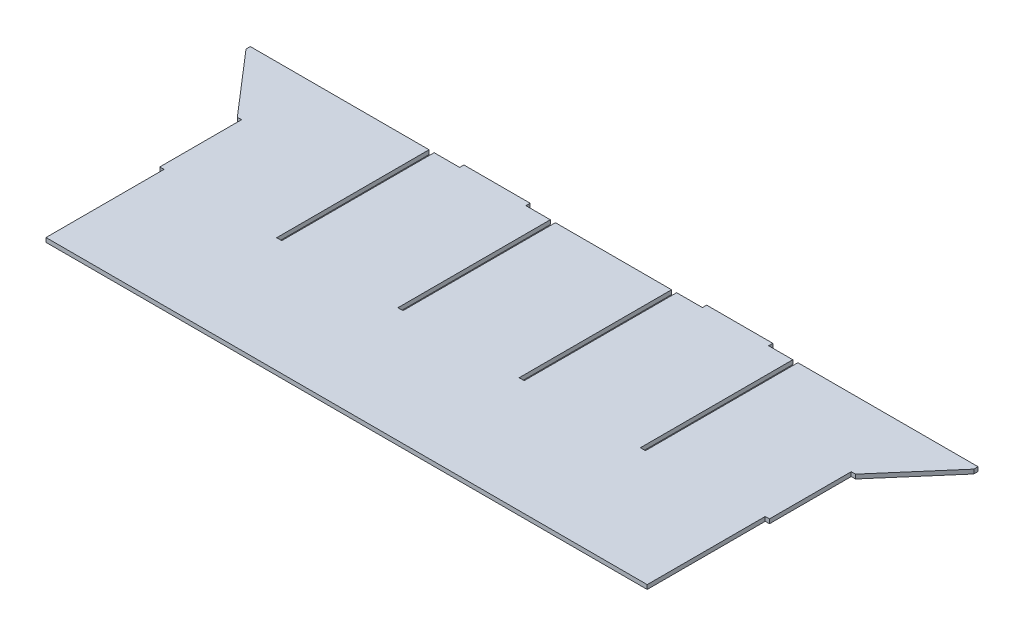
from build123d import *

# Parameters (mm, degrees)
SKETCH1_W           = 457.2230066
SKETCH1_H           = 3.175
BOSS_EXTRUDE1_DEPTH = 200.6419914
SKETCH2_W           = 3.8205
SKETCH2_H           = 114.3
CUT_EXTRUDE1_DEPTH  = 305.188278504
LPATTERN1_COUNT     = 4
LPATTERN1_PITCH     = 90.932
BOSS_EXTRUDE3_DEPTH = 3.175
SKETCH5_W           = 3.175
SKETCH5_H           = 88.514
CUT_EXTRUDE2_DEPTH  = 3.175
SKETCH3_W           = 49.658811606
SKETCH3_H           = 3.175
BOSS_EXTRUDE4_DEPTH = 3.18


with BuildPart() as part:
    # Sketch1 → Boss-Extrude1 (new body)
    with BuildSketch(Plane.XY):
        Rectangle(SKETCH1_W, SKETCH1_H)
    extrude(amount=BOSS_EXTRUDE1_DEPTH)

    # Sketch2 → Cut-Extrude1 (cut, through all)
    with BuildSketch(Plane(origin=(0, 1.5875, 0), x_dir=(1, 0, 0), z_dir=(0, 1, 0))):
        with Locations((135.8962533, -57.15)):
            Rectangle(SKETCH2_W, SKETCH2_H)
    cut_extrude1 = extrude(amount=-CUT_EXTRUDE1_DEPTH, mode=Mode.SUBTRACT)

    # LPattern1: Cut-Extrude1 ×4
    with Locations(*[(-i * LPATTERN1_PITCH, 0, 0) for i in range(1, LPATTERN1_COUNT)]):
        add(cut_extrude1, mode=Mode.SUBTRACT)

    # Sketch4 → Boss-Extrude3 (add)
    with BuildSketch(Plane.XZ.offset(1.5875)):
        Polygon((-228.6115033, 0), (-272.8865033, 0), (-272.8865033, 3.175), (-231.7865033, 50.8), (-228.6115033, 50.8), align=None)
    boss_extrude3 = extrude(amount=-BOSS_EXTRUDE3_DEPTH)

    # Mirror1: Boss-Extrude3 across plane
    add(boss_extrude3.mirror(Plane(origin=(0, 0, 0), x_dir=(0, 0, 1), z_dir=(1, 0, 0))))

    # Sketch5 → Cut-Extrude2 (cut)
    with BuildSketch(Plane.XZ.offset(1.5875)):
        with Locations((-227.0240033, 156.3849914)):
            Rectangle(SKETCH5_W, SKETCH5_H)
    cut_extrude2 = extrude(amount=-CUT_EXTRUDE2_DEPTH, mode=Mode.SUBTRACT)

    # Mirror2: Cut-Extrude2 across plane
    add(cut_extrude2.mirror(Plane(origin=(0, 0, 0), x_dir=(0, 0, 1), z_dir=(1, 0, 0))), mode=Mode.SUBTRACT)

    # Sketch3 → Boss-Extrude4 (add)
    with BuildSketch(Plane(origin=(0, 0, 0), x_dir=(-1, 0, 0), z_dir=(0, 0, -1))):
        with Locations((-91.020094169, 0)):
            Rectangle(SKETCH3_W, SKETCH3_H)
        with Locations((91.020094169, 0)):
            Rectangle(SKETCH3_W, SKETCH3_H)
    extrude(amount=BOSS_EXTRUDE4_DEPTH)


solid = part.part
